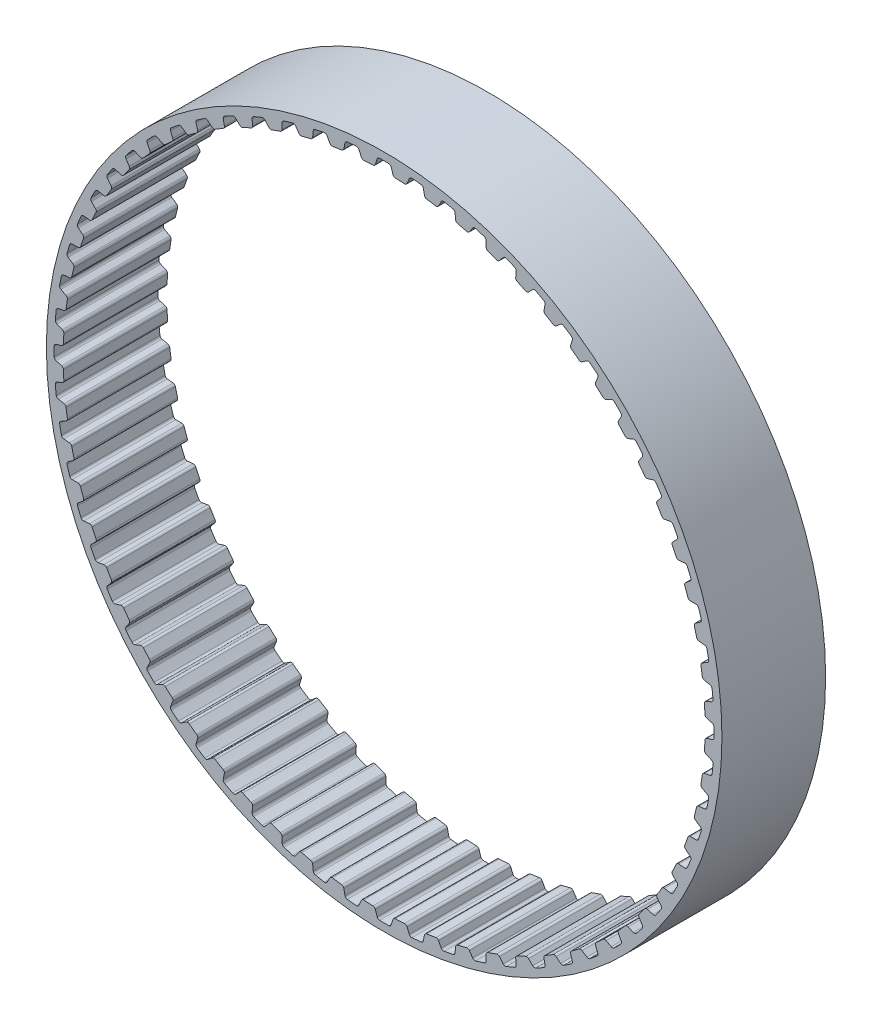
from build123d import *

# Parameters (mm, degrees)
BOSS_EXTRUDE1_DEPTH      = 4.0005
BOSS_EXTRUDE1_DEPTH_BACK = 4.0005
SKETCH4_R                = 26.064812404
SKETCH4_R_2              = 24.764812404
CUT_EXTRUDE1_DEPTH       = 38.077660276
CIRPATTERN1_COUNT        = 64
CUT_EXTRUDE2_START       = -0.3
SKETCH6_R                = 25.914812404
SKETCH6_R_2              = 25.614812404
CUT_EXTRUDE2_DEPTH       = 7.401
SWEEP1_PROFILE_R         = 0.1425
LPATTERN1_COUNT          = 24
LPATTERN1_PITCH          = 0.3


with BuildPart() as part:
    # Sketch4 → Boss-Extrude1 (new, two sides: drawn at the far end of the back side and taken through both)
    with BuildSketch(Plane.XY.offset(-BOSS_EXTRUDE1_DEPTH_BACK)):
        Circle(SKETCH4_R)
        Circle(SKETCH4_R_2, mode=Mode.SUBTRACT)
    extrude(amount=BOSS_EXTRUDE1_DEPTH + BOSS_EXTRUDE1_DEPTH_BACK)

    # Sketch5 → Cut-Extrude1 (cut, symmetric)
    with BuildSketch(Plane.XY):
        with BuildLine():
            Line((-0.860060436, 24.749873322), (0.860060436, 24.749873322))
            ThreePointArc((0.860060436, 24.749873322), (0.745527305, 24.790872647), (0.675937691, 24.890652747))
            Line((0.675937691, 24.890652747), (0.542681858, 25.321465491))
            ThreePointArc((0.542681858, 25.321465491), (0.471431867, 25.422501469), (0.354396711, 25.462346195))
            ThreePointArc((0.354396711, 25.462346195), (0, 25.464812404), (-0.354396711, 25.462346195))
            ThreePointArc((-0.354396711, 25.462346195), (-0.471431867, 25.422501469), (-0.542681858, 25.321465491))
            Line((-0.542681858, 25.321465491), (-0.675937691, 24.890652747))
            ThreePointArc((-0.675937691, 24.890652747), (-0.745527305, 24.790872647), (-0.860060436, 24.749873322))
        make_face()
    cut_extrude1 = extrude(amount=CUT_EXTRUDE1_DEPTH, both=True, mode=Mode.SUBTRACT)

    # CirPattern1: Cut-Extrude1 ×64 about axis
    cirpattern1_axis = Axis((0, 0, 0), (0, 0, 1))
    for i in range(1, CIRPATTERN1_COUNT):
        add(cut_extrude1.rotate(cirpattern1_axis, i * 360 / CIRPATTERN1_COUNT), mode=Mode.SUBTRACT)

    # Sketch6 → Cut-Extrude2 (cut)
    with BuildSketch(Plane.XY.offset(4.0005).offset(CUT_EXTRUDE2_START)):
        Circle(SKETCH6_R)
        Circle(SKETCH6_R_2, mode=Mode.SUBTRACT)
    extrude(amount=-CUT_EXTRUDE2_DEPTH, mode=Mode.SUBTRACT)


with BuildPart() as body_2:
    # Sweep1: sweep along a path in Sketch7
    with BuildLine(Plane(origin=(0, 0, 3.45), x_dir=(-1, 0, 0), z_dir=(0, 0, -1))) as sweep1_path:
        CenterArc((0, 0), 25.764812404, 0, 360)
    # Sweep1 profile (on start of the path) → Sweep1 (sweep)
    with BuildSketch(Plane(origin=(-25.764812404, 0, 3.45), x_dir=(0, 0, 1), z_dir=(0, 1, 0))):
        Circle(SWEEP1_PROFILE_R)
    sweep(path=sweep1_path.line)


with BuildPart() as lpattern1_1:
    # LPattern1: pattern copy
    add(body_2.part.moved(Location(Vector(0, 0, -1) * (1 * LPATTERN1_PITCH))))


with BuildPart() as lpattern1_2:
    # LPattern1: pattern copy
    add(body_2.part.moved(Location(Vector(0, 0, -1) * (2 * LPATTERN1_PITCH))))


with BuildPart() as lpattern1_3:
    # LPattern1: pattern copy
    add(body_2.part.moved(Location(Vector(0, 0, -1) * (3 * LPATTERN1_PITCH))))


with BuildPart() as lpattern1_4:
    # LPattern1: pattern copy
    add(body_2.part.moved(Location(Vector(0, 0, -1) * (4 * LPATTERN1_PITCH))))


with BuildPart() as lpattern1_5:
    # LPattern1: pattern copy
    add(body_2.part.moved(Location(Vector(0, 0, -1) * (5 * LPATTERN1_PITCH))))


with BuildPart() as lpattern1_6:
    # LPattern1: pattern copy
    add(body_2.part.moved(Location(Vector(0, 0, -1) * (6 * LPATTERN1_PITCH))))


with BuildPart() as lpattern1_7:
    # LPattern1: pattern copy
    add(body_2.part.moved(Location(Vector(0, 0, -1) * (7 * LPATTERN1_PITCH))))


with BuildPart() as lpattern1_8:
    # LPattern1: pattern copy
    add(body_2.part.moved(Location(Vector(0, 0, -1) * (8 * LPATTERN1_PITCH))))


with BuildPart() as lpattern1_9:
    # LPattern1: pattern copy
    add(body_2.part.moved(Location(Vector(0, 0, -1) * (9 * LPATTERN1_PITCH))))


with BuildPart() as lpattern1_10:
    # LPattern1: pattern copy
    add(body_2.part.moved(Location(Vector(0, 0, -1) * (10 * LPATTERN1_PITCH))))


with BuildPart() as lpattern1_11:
    # LPattern1: pattern copy
    add(body_2.part.moved(Location(Vector(0, 0, -1) * (11 * LPATTERN1_PITCH))))


with BuildPart() as lpattern1_12:
    # LPattern1: pattern copy
    add(body_2.part.moved(Location(Vector(0, 0, -1) * (12 * LPATTERN1_PITCH))))


with BuildPart() as lpattern1_13:
    # LPattern1: pattern copy
    add(body_2.part.moved(Location(Vector(0, 0, -1) * (13 * LPATTERN1_PITCH))))


with BuildPart() as lpattern1_14:
    # LPattern1: pattern copy
    add(body_2.part.moved(Location(Vector(0, 0, -1) * (14 * LPATTERN1_PITCH))))


with BuildPart() as lpattern1_15:
    # LPattern1: pattern copy
    add(body_2.part.moved(Location(Vector(0, 0, -1) * (15 * LPATTERN1_PITCH))))


with BuildPart() as lpattern1_16:
    # LPattern1: pattern copy
    add(body_2.part.moved(Location(Vector(0, 0, -1) * (16 * LPATTERN1_PITCH))))


with BuildPart() as lpattern1_17:
    # LPattern1: pattern copy
    add(body_2.part.moved(Location(Vector(0, 0, -1) * (17 * LPATTERN1_PITCH))))


with BuildPart() as lpattern1_18:
    # LPattern1: pattern copy
    add(body_2.part.moved(Location(Vector(0, 0, -1) * (18 * LPATTERN1_PITCH))))


with BuildPart() as lpattern1_19:
    # LPattern1: pattern copy
    add(body_2.part.moved(Location(Vector(0, 0, -1) * (19 * LPATTERN1_PITCH))))


with BuildPart() as lpattern1_20:
    # LPattern1: pattern copy
    add(body_2.part.moved(Location(Vector(0, 0, -1) * (20 * LPATTERN1_PITCH))))


with BuildPart() as lpattern1_21:
    # LPattern1: pattern copy
    add(body_2.part.moved(Location(Vector(0, 0, -1) * (21 * LPATTERN1_PITCH))))


with BuildPart() as lpattern1_22:
    # LPattern1: pattern copy
    add(body_2.part.moved(Location(Vector(0, 0, -1) * (22 * LPATTERN1_PITCH))))


with BuildPart() as lpattern1_23:
    # LPattern1: pattern copy
    add(body_2.part.moved(Location(Vector(0, 0, -1) * (23 * LPATTERN1_PITCH))))


solid = Compound([part.part, body_2.part, lpattern1_1.part, lpattern1_2.part, lpattern1_3.part, lpattern1_4.part, lpattern1_5.part, lpattern1_6.part, lpattern1_7.part, lpattern1_8.part, lpattern1_9.part, lpattern1_10.part, lpattern1_11.part, lpattern1_12.part, lpattern1_13.part, lpattern1_14.part, lpattern1_15.part, lpattern1_16.part, lpattern1_17.part, lpattern1_18.part, lpattern1_19.part, lpattern1_20.part, lpattern1_21.part, lpattern1_22.part, lpattern1_23.part])
